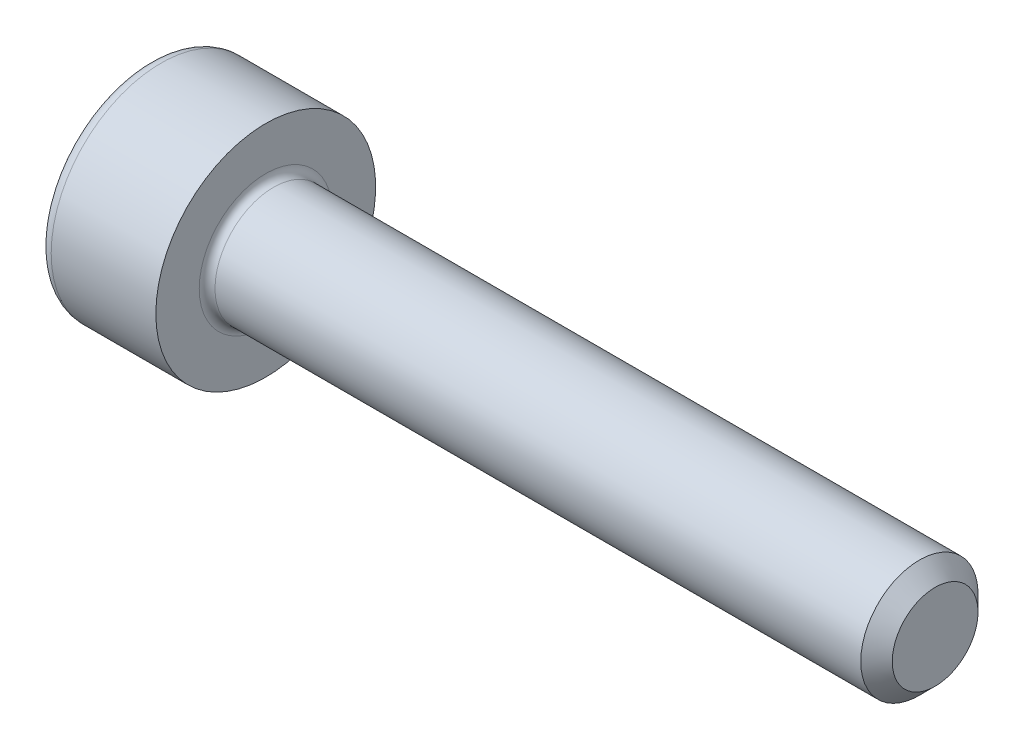
from build123d import *

# Parameters (mm, degrees)
FILLET1_R      = 0.1
FILLET2_R      = 0.16
CHAMFER1_SIZE  = 0.2
EXTRUDE1_DEPTH = 0.7


with BuildPart() as part:
    # Sketch1 → Revolve1 (revolve)
    with BuildSketch(Plane.XY):
        Polygon((0, 1.395688245), (0, 0), (9.988734128, 0), (9.988734128, 0.744367064), (1.488734128, 0.744367064), (1.488734128, 1.395688245), align=None)
    revolve(axis=Axis((0, 0, 0), (1, 0, 0)))

    # Fillet1
    fillet1_edges = [part.edges().sort_by_distance(p)[0] for p in [
        (1.488734128, -0.744367064, 0),
    ]]
    fillet(fillet1_edges, radius=FILLET1_R)

    # Fillet2
    fillet2_edges = [part.edges().sort_by_distance(p)[0] for p in [
        (0, -1.395688245, 0),
    ]]
    fillet(fillet2_edges, radius=FILLET2_R)

    # Chamfer1
    chamfer1_edges = [part.edges().sort_by_distance(p)[0] for p in [
        (9.988734128, -0.744367064, 0),
    ]]
    chamfer(chamfer1_edges, length=CHAMFER1_SIZE)

    # Sketch2 → Extrude1 (cut)
    with BuildSketch(Plane.ZY):
        Polygon((0, 0.877572409), (-0.76, 0.438786205), (-0.76, -0.438786205), (0, -0.877572409), (0.76, -0.438786205), (0.76, 0.438786205), align=None)
    extrude(amount=-EXTRUDE1_DEPTH, mode=Mode.SUBTRACT)


solid = part.part
